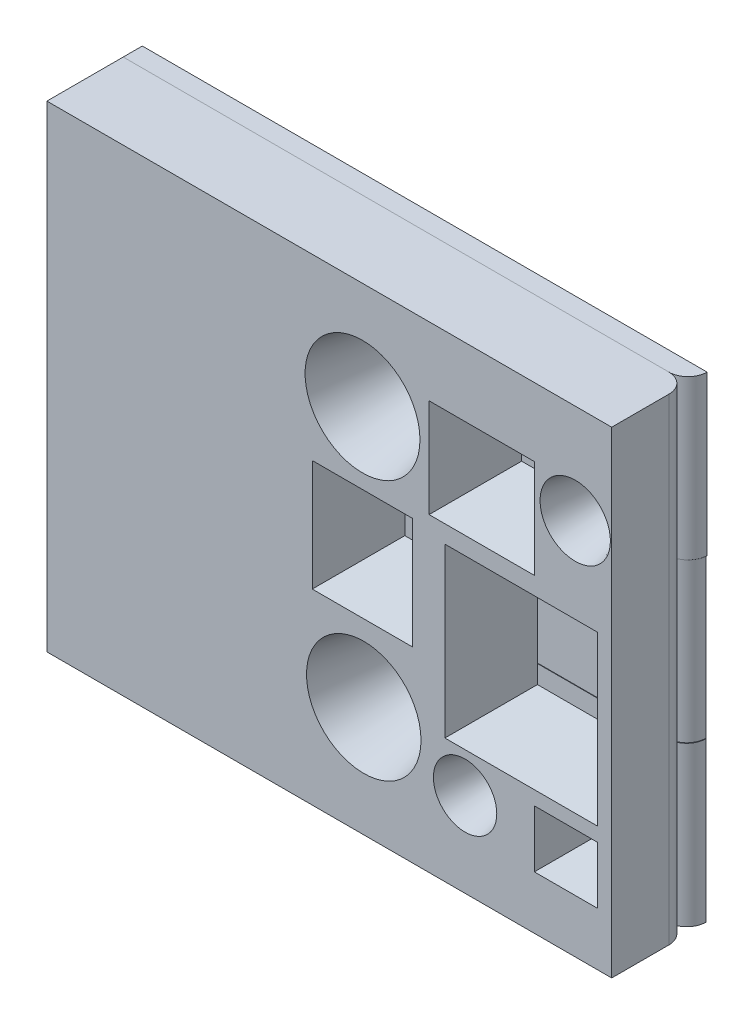
from build123d import *

# Parameters (mm, degrees)
SKETCH2_W                    = 296
SKETCH2_H                    = 250
BOSS_EXTRUDE1_DEPTH          = 40
BOSS_EXTRUDE2_DEPTH          = 10
SKETCH4_W                    = 295.362249347
SKETCH4_H                    = 83.190562337
BOSS_EXTRUDE2_2_DEPTH        = 10
SKETCH4_H_2                  = 83.264102062
BOSS_EXTRUDE2_3_DEPTH        = 10
FILLET1_R                    = 10
FILLET4_R                    = 10
FILLET5_R                    = 10
FILLET6_R                    = 10
SKETCH8_R                    = 30.097695609
CUT_EXTRUDE1_DEPTH           = 45
CUT_EXTRUDE1_DRAFT           = -12
SKETCH8_R_2                  = 30
CUT_EXTRUDE1_PROFILE_2_DEPTH = 45
CUT_EXTRUDE1_PROFILE_2_DRAFT = -12
SKETCH8_R_3                  = 18.430965522
CUT_EXTRUDE1_PROFILE_3_DEPTH = 45
CUT_EXTRUDE1_PROFILE_3_DRAFT = -12
SKETCH8_R_4                  = 16.602168906
CUT_EXTRUDE1_PROFILE_4_DEPTH = 45
CUT_EXTRUDE1_PROFILE_4_DRAFT = -12
SKETCH8_W                    = 52.614428909
SKETCH8_H                    = 58.35418479
CUT_EXTRUDE1_PROFILE_5_DEPTH = 45
CUT_EXTRUDE1_PROFILE_5_DRAFT = -12
SKETCH8_W_2                  = 80.037707008
SKETCH8_H_2                  = 88.009590175
CUT_EXTRUDE1_PROFILE_6_DEPTH = 45
CUT_EXTRUDE1_PROFILE_6_DRAFT = -12
SKETCH8_W_3                  = 55.165431523
SKETCH8_H_3                  = 51.657802929
CUT_EXTRUDE1_PROFILE_7_DEPTH = 45
CUT_EXTRUDE1_PROFILE_7_DRAFT = -12
SKETCH8_W_4                  = 33.163033979
SKETCH8_H_4                  = 29.974280712
CUT_EXTRUDE1_PROFILE_8_DEPTH = 45
CUT_EXTRUDE1_PROFILE_8_DRAFT = -12


with BuildPart() as part:
    # Sketch2 → Boss-Extrude1 (new body)
    with BuildSketch(Plane.XY):
        with Locations((148, 125)):
            Rectangle(SKETCH2_W, SKETCH2_H)
    extrude(amount=BOSS_EXTRUDE1_DEPTH)

    # Fillet1
    fillet1_edges = [part.edges().sort_by_distance(p)[0] for p in [
        (296, 125, 0),
    ]]
    fillet(fillet1_edges, radius=FILLET1_R)


with BuildPart() as body_2:
    # Sketch4 → Boss-Extrude2 (new body)
    with BuildSketch(Plane(origin=(0, 0, 0), x_dir=(-1, 0, 0), z_dir=(0, 0, -1))):
        Polygon((0, 250), (-296, 250), (-296, 166.7), (-295.362249347, 166.7), (-295.362249347, 166.809437663), (0, 166.809437663), align=None)
    extrude(amount=BOSS_EXTRUDE2_DEPTH)

    # Fillet4
    fillet4_edges = [body_2.edges().sort_by_distance(p)[0] for p in [
        (296, 208.35, 0),
    ]]
    fillet(fillet4_edges, radius=FILLET4_R - 0.0001)  # a hair under: the kernel refuses the full size


with BuildPart() as body_3:
    # Sketch4 → Boss-Extrude2 2 (new body)
    with BuildSketch(Plane(origin=(0, 0, 0), x_dir=(-1, 0, 0), z_dir=(0, 0, -1))):
        with Locations((-147.681124674, 125.104718832)):
            Rectangle(SKETCH4_W, SKETCH4_H)
    extrude(amount=BOSS_EXTRUDE2_2_DEPTH)

    # Fillet5
    fillet5_edges = [body_3.edges().sort_by_distance(p)[0] for p in [
        (295.362249347, 125.104718832, 0),
    ]]
    fillet(fillet5_edges, radius=FILLET5_R - 0.0001)  # a hair under: the kernel refuses the full size


with BuildPart() as body_4:
    # Sketch4 → Boss-Extrude2 3 (new body)
    with BuildSketch(Plane(origin=(0, 0, 0), x_dir=(-1, 0, 0), z_dir=(0, 0, -1))):
        with Locations((-147.681124674, 41.632051031)):
            Rectangle(SKETCH4_W, SKETCH4_H_2)
    extrude(amount=BOSS_EXTRUDE2_3_DEPTH)

    # Fillet6
    fillet6_edges = [body_4.edges().sort_by_distance(p)[0] for p in [
        (295.362249347, 41.632051031, 0),
    ]]
    fillet(fillet6_edges, radius=FILLET6_R - 0.0001)  # a hair under: the kernel refuses the full size


with BuildPart() as cut_extrude1_tool:
    # Sketch8 → Cut-Extrude1 (with draft: the straight prism first)
    with BuildSketch(Plane.XY.offset(40)):
        with Locations((165.416417311, 194.036508235)):
            Circle(SKETCH8_R)
    extrude(amount=-CUT_EXTRUDE1_DEPTH)
    # Cut-Extrude1: the draft: its side faces are tilted about the plane it starts from
    cut_extrude1_sides = [cut_extrude1_tool.faces().sort_by_distance(p)[0] for p in [
        (135.318721702, 194.036508235, 17.5),
    ]]
    draft(cut_extrude1_sides, Plane.XY.offset(40), CUT_EXTRUDE1_DRAFT)


with BuildPart() as part_1:
    add(part.part)

    # Cut-Extrude1: cut by cut_extrude1_tool
    add(cut_extrude1_tool.part, mode=Mode.SUBTRACT)


with BuildPart() as cut_extrude1_profile_2_tool:
    # Sketch8 → Cut-Extrude1 profile 2 (with draft: the straight prism first)
    with BuildSketch(Plane.XY.offset(40)):
        with Locations((166.066556831, 57.876743725)):
            Circle(SKETCH8_R_2)
    extrude(amount=-CUT_EXTRUDE1_PROFILE_2_DEPTH)
    # Cut-Extrude1 profile 2: the draft: its side faces are tilted about the plane it starts from
    cut_extrude1_profile_2_sides = [cut_extrude1_profile_2_tool.faces().sort_by_distance(p)[0] for p in [
        (136.066556831, 57.876743725, 17.5),
    ]]
    draft(cut_extrude1_profile_2_sides, Plane.XY.offset(40), CUT_EXTRUDE1_PROFILE_2_DRAFT)


with BuildPart() as part_2:
    add(part_1.part)

    # Cut-Extrude1 profile 2: cut by cut_extrude1_profile_2_tool
    add(cut_extrude1_profile_2_tool.part, mode=Mode.SUBTRACT)


with BuildPart() as cut_extrude1_profile_3_tool:
    # Sketch8 → Cut-Extrude1 profile 3 (with draft: the straight prism first)
    with BuildSketch(Plane.XY.offset(40)):
        with Locations((276.887756181, 197.990617675)):
            Circle(SKETCH8_R_3)
    extrude(amount=-CUT_EXTRUDE1_PROFILE_3_DEPTH)
    # Cut-Extrude1 profile 3: the draft: its side faces are tilted about the plane it starts from
    cut_extrude1_profile_3_sides = [cut_extrude1_profile_3_tool.faces().sort_by_distance(p)[0] for p in [
        (258.456790659, 197.990617675, 17.5),
    ]]
    draft(cut_extrude1_profile_3_sides, Plane.XY.offset(40), CUT_EXTRUDE1_PROFILE_3_DRAFT)


with BuildPart() as part_3:
    add(part_2.part)

    # Cut-Extrude1 profile 3: cut by cut_extrude1_profile_3_tool
    add(cut_extrude1_profile_3_tool.part, mode=Mode.SUBTRACT)


with BuildPart() as cut_extrude1_profile_4_tool:
    # Sketch8 → Cut-Extrude1 profile 4 (with draft: the straight prism first)
    with BuildSketch(Plane.XY.offset(40)):
        with Locations((219.161303371, 44.386097935)):
            Circle(SKETCH8_R_4)
    extrude(amount=-CUT_EXTRUDE1_PROFILE_4_DEPTH)
    # Cut-Extrude1 profile 4: the draft: its side faces are tilted about the plane it starts from
    cut_extrude1_profile_4_sides = [cut_extrude1_profile_4_tool.faces().sort_by_distance(p)[0] for p in [
        (202.559134465, 44.386097935, 17.5),
    ]]
    draft(cut_extrude1_profile_4_sides, Plane.XY.offset(40), CUT_EXTRUDE1_PROFILE_4_DRAFT)


with BuildPart() as part_4:
    add(part_3.part)

    # Cut-Extrude1 profile 4: cut by cut_extrude1_profile_4_tool
    add(cut_extrude1_profile_4_tool.part, mode=Mode.SUBTRACT)


with BuildPart() as cut_extrude1_profile_5_tool:
    # Sketch8 → Cut-Extrude1 profile 5 (with draft: the straight prism first)
    with BuildSketch(Plane.XY.offset(40)):
        with Locations((165.378705307, 127.232127287)):
            Rectangle(SKETCH8_W, SKETCH8_H)
    extrude(amount=-CUT_EXTRUDE1_PROFILE_5_DEPTH)
    # Cut-Extrude1 profile 5: the draft: its side faces are tilted about the plane it starts from
    cut_extrude1_profile_5_sides = [cut_extrude1_profile_5_tool.faces().sort_by_distance(p)[0] for p in [
        (139.071490852, 127.232127287, 17.5),
        (165.378705306, 98.055034892, 17.5),
        (191.685919761, 127.232127287, 17.5),
        (165.378705306, 156.409219682, 17.5),
    ]]
    draft(cut_extrude1_profile_5_sides, Plane.XY.offset(40), CUT_EXTRUDE1_PROFILE_5_DRAFT)


with BuildPart() as part_5:
    add(part_4.part)

    # Cut-Extrude1 profile 5: cut by cut_extrude1_profile_5_tool
    add(cut_extrude1_profile_5_tool.part, mode=Mode.SUBTRACT)


with BuildPart() as cut_extrude1_profile_6_tool:
    # Sketch8 → Cut-Extrude1 profile 6 (with draft: the straight prism first)
    with BuildSketch(Plane.XY.offset(40)):
        with Locations((248.605165581, 109.215671328)):
            Rectangle(SKETCH8_W_2, SKETCH8_H_2)
    extrude(amount=-CUT_EXTRUDE1_PROFILE_6_DEPTH)
    # Cut-Extrude1 profile 6: the draft: its side faces are tilted about the plane it starts from
    cut_extrude1_profile_6_sides = [cut_extrude1_profile_6_tool.faces().sort_by_distance(p)[0] for p in [
        (208.586312077, 109.215671327, 17.5),
        (248.605165581, 65.21087624, 17.5),
        (288.624019085, 109.215671327, 17.5),
        (248.605165581, 153.220466415, 17.5),
    ]]
    draft(cut_extrude1_profile_6_sides, Plane.XY.offset(40), CUT_EXTRUDE1_PROFILE_6_DRAFT)


with BuildPart() as part_6:
    add(part_5.part)

    # Cut-Extrude1 profile 6: cut by cut_extrude1_profile_6_tool
    add(cut_extrude1_profile_6_tool.part, mode=Mode.SUBTRACT)


with BuildPart() as cut_extrude1_profile_7_tool:
    # Sketch8 → Cut-Extrude1 profile 7 (with draft: the straight prism first)
    with BuildSketch(Plane.XY.offset(40)):
        with Locations((227.878269345, 188.296752355)):
            Rectangle(SKETCH8_W_3, SKETCH8_H_3)
    extrude(amount=-CUT_EXTRUDE1_PROFILE_7_DEPTH)
    # Cut-Extrude1 profile 7: the draft: its side faces are tilted about the plane it starts from
    cut_extrude1_profile_7_sides = [cut_extrude1_profile_7_tool.faces().sort_by_distance(p)[0] for p in [
        (200.295553583, 188.296752354, 17.5),
        (227.878269344, 162.46785089, 17.5),
        (255.460985106, 188.296752354, 17.5),
        (227.878269344, 214.125653819, 17.5),
    ]]
    draft(cut_extrude1_profile_7_sides, Plane.XY.offset(40), CUT_EXTRUDE1_PROFILE_7_DRAFT)


with BuildPart() as part_7:
    add(part_6.part)

    # Cut-Extrude1 profile 7: cut by cut_extrude1_profile_7_tool
    add(cut_extrude1_profile_7_tool.part, mode=Mode.SUBTRACT)


with BuildPart() as cut_extrude1_profile_8_tool:
    # Sketch8 → Cut-Extrude1 profile 8 (with draft: the straight prism first)
    with BuildSketch(Plane.XY.offset(40)):
        with Locations((272.042502096, 42.889603369)):
            Rectangle(SKETCH8_W_4, SKETCH8_H_4)
    extrude(amount=-CUT_EXTRUDE1_PROFILE_8_DEPTH)
    # Cut-Extrude1 profile 8: the draft: its side faces are tilted about the plane it starts from
    cut_extrude1_profile_8_sides = [cut_extrude1_profile_8_tool.faces().sort_by_distance(p)[0] for p in [
        (255.460985106, 42.889603369, 17.5),
        (272.042502095, 27.902463013, 17.5),
        (288.624019085, 42.889603369, 17.5),
        (272.042502095, 57.876743725, 17.5),
    ]]
    draft(cut_extrude1_profile_8_sides, Plane.XY.offset(40), CUT_EXTRUDE1_PROFILE_8_DRAFT)


with BuildPart() as part_8:
    add(part_7.part)

    # Cut-Extrude1 profile 8: cut by cut_extrude1_profile_8_tool
    add(cut_extrude1_profile_8_tool.part, mode=Mode.SUBTRACT)


solid = Compound([body_2.part, body_3.part, body_4.part, part_8.part])
